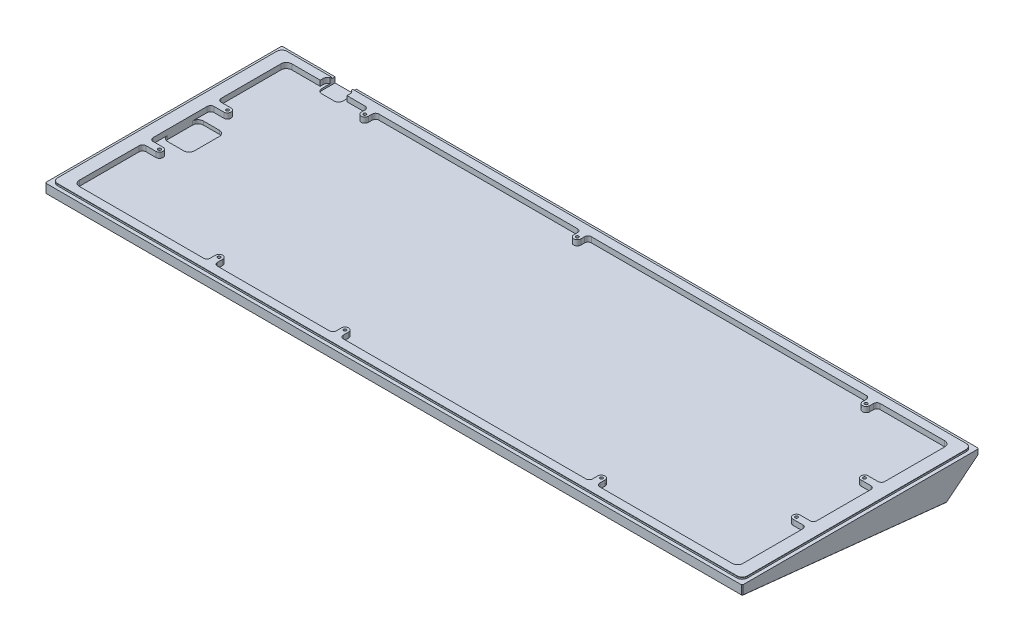
from build123d import *
from OCP.BRepFilletAPI import BRepFilletAPI_MakeChamfer

# Parameters (mm, degrees)
SKETCH1_W                 = 390.7
SKETCH1_H                 = 132.7
MAINBODY_DEPTH            = 18.5
SKETCH2_W                 = 390.7
SKETCH2_H                 = 132.7
SKETCH2_W_2               = 386.7
SKETCH2_H_2               = 128.7
ALIGMENTLIP_DEPTH         = 1
TYPINGANGLE_DEPTH         = 414.035143783
SKETCH4_W                 = 372
SKETCH4_H                 = 119.1
PCBCUTOUT_DEPTH           = 3
SKETCH13_W                = 15
SKETCH13_H                = 20
CUT_EXTRUDE4_DEPTH        = 2
FILLET2_R                 = 3
CHAMFER1_SIZE             = 0.5
CHAMFER1_SIZE_2           = 0.561801899
CHAMFER2_SIZE             = 0.1
SKETCH17_R                = 1
SKETCH17_W                = 2
SKETCH17_H                = 2
CUT_EXTRUDE5_DEPTH        = 1
SKETCH18_W                = 12
SKETCH18_H                = 4
CUT_EXTRUDE6_DEPTH        = 10
SKETCH12_W                = 15
SKETCH12_H                = 3.95
CUT_EXTRUDE3_DEPTH        = 3
FILLET1_R                 = 2.5
SKETCH19_R                = 2
SKETCH19_W                = 4
SKETCH19_H                = 4
SKETCH19_W_2              = 7.45
SKETCH19_H_2              = 4.8
BOSS_EXTRUDE1_DEPTH       = 3
FILLET3_R                 = 1.9
M2X0_4_TAPPED_HOLE1_D     = 1.6
M2X0_4_TAPPED_HOLE1_DEPTH = 4
M2X0_4_TAPPED_HOLE1_TIP   = 0.480688495


# Some blends are built 0.0001 mm under size
with BuildPart() as part:
    # Sketch1 → MainBody (new body)
    with BuildSketch(Plane(origin=(0, 0, 0), x_dir=(1, 0, 0), z_dir=(0, 1, 0))):
        with Locations((195.35, 66.35)):
            Rectangle(SKETCH1_W, SKETCH1_H)
    extrude(amount=MAINBODY_DEPTH)

    # Sketch2 → AligmentLip (cut)
    with BuildSketch(Plane(origin=(0, 18.5, 0), x_dir=(1, 0, 0), z_dir=(0, 1, 0))):
        with Locations((195.35, 66.35)):
            Rectangle(SKETCH2_W, SKETCH2_H)
        with Locations((195.35, 66.35)):
            Rectangle(SKETCH2_W_2, SKETCH2_H_2, mode=Mode.SUBTRACT)
    extrude(amount=-ALIGMENTLIP_DEPTH, mode=Mode.SUBTRACT)

    # Sketch3 → TypingAngle (cut, through all)
    with BuildSketch(Plane.ZY):
        Polygon((-114.79399123, 0), (-132.7, 14.5), (-132.7, 0), align=None)
        Polygon((0, 12.065334661), (-114.79399123, 0), (0, 0), align=None)
    extrude(amount=-TYPINGANGLE_DEPTH, mode=Mode.SUBTRACT)

    # Sketch4 → PCBCutout (cut)
    with BuildSketch(Plane(origin=(0, 18.5, 0), x_dir=(1, 0, 0), z_dir=(0, 1, 0))):
        with Locations((195.35, 66.35)):
            Rectangle(SKETCH4_W, SKETCH4_H)
    extrude(amount=-PCBCUTOUT_DEPTH, mode=Mode.SUBTRACT)

    # Sketch13 → Cut-Extrude4 (cut)
    with BuildSketch(Plane(origin=(0, 15.5, 0), x_dir=(1, 0, 0), z_dir=(0, 1, 0))):
        with Locations((16.85, 66.35)):
            Rectangle(SKETCH13_W, SKETCH13_H)
    extrude(amount=-CUT_EXTRUDE4_DEPTH, mode=Mode.SUBTRACT)

    # Fillet2
    fillet2_edges = [part.edges().sort_by_distance(p)[0] for p in [
        (388.7, 18, -130.7),
        (2, 18, -130.7),
        (2, 18, -2),
        (388.7, 18, -2),
        (9.35, 17, -6.8),
        (9.35, 17, -125.9),
        (381.35, 17, -125.9),
        (381.35, 17, -6.8),
        (9.35, 14.5, -56.35),
        (9.35, 14.5, -76.35),
        (24.35, 14.5, -76.35),
        (24.35, 14.5, -56.35),
    ]]
    fillet(fillet2_edges, radius=FILLET2_R)

    # Chamfer1
    chamfer1_edges_1 = [part.edges().sort_by_distance(p)[0] for p in [
        (0, 16, -132.7),
        (390.7, 16, -132.7),
        (390.7, 14.782667331, 0),
        (0, 14.782667331, 0),
        (0, 7.25, -123.746995615),
        (390.7, 7.25, -123.746995615),
        (0, 6.032667331, -57.396995615),
        (390.7, 6.032667331, -57.396995615),
    ]]
    chamfer1_edges_2 = [part.edges().sort_by_distance(p)[0] for p in [
        (195.35, 12.065334661, 0),
    ]]
    chamfer1_side_2 = [part.faces().sort_by_distance(p)[0] for p in [
        (195.35, 12.064289377, -0.009945219),
    ]]
    chamfer1 = BRepFilletAPI_MakeChamfer(part.part.solid().wrapped)
    for e in chamfer1_edges_1:
        chamfer1.Add(CHAMFER1_SIZE - 0.0001, e.wrapped)
    for e in chamfer1_edges_2:
        chamfer1.Add(CHAMFER1_SIZE_2 - 0.0001, CHAMFER1_SIZE - 0.0001, e.wrapped, chamfer1_side_2[0].wrapped)
    add(Compound.cast(chamfer1.Shape()), mode=Mode.REPLACE)  # a hair under: the kernel refuses the full size

    # Chamfer2
    chamfer2_edges = [part.edges().sort_by_distance(p)[0] for p in [
        (388.7, 18.5, -66.35),
        (195.35, 18.5, -130.7),
        (2, 18.5, -66.35),
        (195.35, 18.5, -2),
        (2.878679656, 18.5, -129.821320344),
        (2.878679656, 18.5, -2.878679656),
        (387.821320344, 18.5, -2.878679656),
        (387.821320344, 18.5, -129.821320344),
    ]]
    chamfer(chamfer2_edges, length=CHAMFER2_SIZE)

    # Sketch17 → Cut-Extrude5 (cut)
    with BuildSketch(Plane(origin=(0, 11.933506406, -1.254262065), x_dir=(1, 0, 0), z_dir=(0, -0.9945218953682734, 0.10452846326765429))):
        with Locations((205.1, -52.238829109)):
            Circle(SKETCH17_R)
        with BuildLine():
            ThreePointArc((204.1, -52.238829109), (205.1, -51.238829109), (206.1, -52.238829109))
            Line((206.1, -52.238829109), (206.1, -49.738829109))
            ThreePointArc((206.1, -49.738829109), (205.1, -50.738829109), (204.1, -49.738829109))
            Line((204.1, -49.738829109), (204.1, -52.238829109))
        make_face()
        with Locations((205.1, -49.738829109)):
            Circle(SKETCH17_R)
        with Locations((201.6, -49.738829109)):
            Circle(SKETCH17_R)
        with BuildLine():
            ThreePointArc((200.6, -60.238829109), (201.6, -59.238829109), (202.6, -60.238829109))
            Line((202.6, -60.238829109), (202.6, -49.738829109))
            ThreePointArc((202.6, -49.738829109), (201.6, -50.738829109), (200.6, -49.738829109))
            Line((200.6, -49.738829109), (200.6, -60.238829109))
        make_face()
        with Locations((201.6, -60.238829109)):
            Circle(SKETCH17_R)
        with Locations((197.1, -53.738829109)):
            Circle(SKETCH17_R)
        with BuildLine():
            Line((196.1, -62.738829109), (198.1, -62.738829109))
            Line((198.1, -62.738829109), (198.1, -53.738829109))
            ThreePointArc((198.1, -53.738829109), (197.1, -54.738829109), (196.1, -53.738829109))
            Line((196.1, -53.738829109), (196.1, -62.738829109))
        make_face()
        with Locations((197.1, -63.738829109)):
            Rectangle(SKETCH17_W, SKETCH17_H)
        with BuildLine():
            ThreePointArc((196.1, -67.738829109), (197.1, -66.738829109), (198.1, -67.738829109))
            Line((198.1, -67.738829109), (198.1, -64.738829109))
            Line((198.1, -64.738829109), (196.1, -64.738829109))
            Line((196.1, -64.738829109), (196.1, -67.738829109))
        make_face()
        with Locations((197.1, -67.738829109)):
            Circle(SKETCH17_R)
        with BuildLine():
            Line((194.1, -64.738829109), (196.1, -64.738829109))
            Line((196.1, -64.738829109), (196.1, -62.738829109))
            Line((196.1, -62.738829109), (194.1, -62.738829109))
            ThreePointArc((194.1, -62.738829109), (194.807106781, -63.031722328), (195.1, -63.738829109))
            ThreePointArc((195.1, -63.738829109), (194.807106781, -64.44593589), (194.1, -64.738829109))
        make_face()
        with Locations((194.1, -63.738829109)):
            Circle(SKETCH17_R)
        with Locations(Location((201.6, -63.738829109, 0), (0, 0, 270))):
            Circle(SKETCH17_R)
        with Locations((192.6, -60.238829109)):
            Circle(SKETCH17_R)
        with BuildLine():
            ThreePointArc((191.6, -60.238829109), (192.6, -59.238829109), (193.6, -60.238829109))
            Line((193.6, -60.238829109), (193.6, -54.238829109))
            ThreePointArc((193.6, -54.238829109), (192.6, -55.238829109), (191.6, -54.238829109))
            Line((191.6, -54.238829109), (191.6, -60.238829109))
        make_face()
        with Locations((192.6, -54.238829109)):
            Circle(SKETCH17_R)
        with BuildLine():
            ThreePointArc((188.1, -60.238829109), (189.1, -59.238829109), (190.1, -60.238829109))
            Line((190.1, -60.238829109), (190.1, -54.238829109))
            ThreePointArc((190.1, -54.238829109), (189.1, -55.238829109), (188.1, -54.238829109))
            Line((188.1, -54.238829109), (188.1, -60.238829109))
        make_face()
        with Locations((189.1, -60.238829109)):
            Circle(SKETCH17_R)
        with Locations((189.1, -54.238829109)):
            Circle(SKETCH17_R)
        with Locations((185.6, -54.238829109)):
            Circle(SKETCH17_R)
        with BuildLine():
            ThreePointArc((184.6, -60.238829109), (185.6, -59.238829109), (186.6, -60.238829109))
            Line((186.6, -60.238829109), (186.6, -54.238829109))
            ThreePointArc((186.6, -54.238829109), (185.6, -55.238829109), (184.6, -54.238829109))
            Line((184.6, -54.238829109), (184.6, -60.238829109))
        make_face()
        with Locations((185.6, -60.238829109)):
            Circle(SKETCH17_R)
    extrude(amount=-CUT_EXTRUDE5_DEPTH, mode=Mode.SUBTRACT)

    # Sketch18 → Cut-Extrude6 (cut)
    with BuildSketch(Plane(origin=(0, 0, -132.7), x_dir=(-1, 0, 0), z_dir=(0, 0, -1))):
        with Locations((-35.8, 16.5)):
            Rectangle(SKETCH18_W, SKETCH18_H)
    extrude(amount=-CUT_EXTRUDE6_DEPTH, mode=Mode.SUBTRACT)

    # Sketch12 → Cut-Extrude3 (cut)
    with BuildSketch(Plane(origin=(0, 18.5, 0), x_dir=(1, 0, 0), z_dir=(0, 1, 0))):
        with Locations((35.8, 127.875)):
            Rectangle(SKETCH12_W, SKETCH12_H)
    extrude(amount=-CUT_EXTRUDE3_DEPTH, mode=Mode.SUBTRACT)

    # Fillet1
    # the kernel refuses this fillet: 2.5 mm, written as the material it adds along each edge
    with BuildSketch(Plane(origin=(43.3, 18.5, -129.85), x_dir=(-1, 0, 0), z_dir=(0, -1, 0))) as fillet1_piece_1_section:
        with BuildLine():
            CenterArc((2.5, -2.291287847), FILLET1_R, 113.578178478, 66.421821522)
            Line((0, -2.291287847), (0, 0))
            Line((0, 0), (1.5, 0))
        make_face()
    fillet1_piece_1 = extrude(amount=8.728219619, mode=Mode.PRIVATE)
    fillet1_piece_1 = split(fillet1_piece_1, bisect_by=Plane(origin=(42.895833366, 13.646672466, -131.646228254), z_dir=(0, 0.7771459614569703, 0.6293203910498382)), keep=Keep.TOP, mode=Mode.PRIVATE)
    add(fillet1_piece_1)
    with BuildSketch(Plane(origin=(28.3, 18.5, -129.85), x_dir=(0, 0, 1), z_dir=(0, -1, 0))) as fillet1_piece_2_section:
        with BuildLine():
            CenterArc((2.291287847, -2.5), FILLET1_R, 90, 66.421821522)
            Line((0, -1.5), (0, 0))
            Line((0, 0), (2.291287847, 0))
        make_face()
    fillet1_piece_2 = extrude(amount=8.728219619, mode=Mode.PRIVATE)
    fillet1_piece_2 = split(fillet1_piece_2, bisect_by=Plane(origin=(28.704166634, 13.646672466, -131.646228254), z_dir=(0, 0.7771459614569703, 0.6293203910498382)), keep=Keep.TOP, mode=Mode.PRIVATE)
    add(fillet1_piece_2)
    with BuildSketch(Plane(origin=(41.8, 8.25, -122.7), x_dir=(0, 0, -1), z_dir=(0, 1, 0))) as fillet1_piece_3_section:
        with BuildLine():
            CenterArc((FILLET1_R, FILLET1_R), FILLET1_R, 180, 90)
            Line((0, FILLET1_R), (0, 0))
            Line((0, 0), (FILLET1_R, 0))
        make_face()
    fillet1_piece_3 = extrude(amount=7.25, mode=Mode.PRIVATE)
    fillet1_piece_3 = split(fillet1_piece_3, bisect_by=Plane(origin=(41.241580153, 10.080392591, -127.242239377), z_dir=(0, 0.7771459614569703, 0.6293203910498382)), keep=Keep.TOP, mode=Mode.PRIVATE)
    add(fillet1_piece_3)
    with BuildSketch(Plane(origin=(29.8, 15.5, -122.7), x_dir=(1, 0, 0), z_dir=(0, -1, 0))) as fillet1_piece_4_section:
        with BuildLine():
            CenterArc((FILLET1_R, -FILLET1_R), FILLET1_R, 90, 90)
            Line((0, -FILLET1_R), (0, 0))
            Line((0, 0), (FILLET1_R, 0))
        make_face()
    fillet1_piece_4 = extrude(amount=7.25, mode=Mode.PRIVATE)
    fillet1_piece_4 = split(fillet1_piece_4, bisect_by=Plane(origin=(30.358419847, 10.080392591, -127.242239377), z_dir=(0, 0.7771459614569703, 0.6293203910498382)), keep=Keep.TOP, mode=Mode.PRIVATE)
    add(fillet1_piece_4)

    # Sketch19 → Boss-Extrude1 (add)
    with BuildSketch(Plane(origin=(0, 15.5, 0), x_dir=(1, 0, 0), z_dir=(0, 1, 0))):
        with Locations((57.3, 121.9)):
            Circle(SKETCH19_R)
        with Locations((176.4, 121.9)):
            Circle(SKETCH19_R)
        with Locations((338.3, 121.9)):
            Circle(SKETCH19_R)
        with Locations((16.8, 85.4)):
            Circle(SKETCH19_R)
        with Locations((16.8, 47.3)):
            Circle(SKETCH19_R)
        with Locations((85.9, 11.6)):
            Circle(SKETCH19_R)
        with Locations((156.5, 11.6)):
            Circle(SKETCH19_R)
        with Locations((300.2, 11.6)):
            Circle(SKETCH19_R)
        with Locations((373.9, 85.4)):
            Circle(SKETCH19_R)
        with Locations((373.9, 47.3)):
            Circle(SKETCH19_R)
        with Locations((57.3, 123.9)):
            Rectangle(SKETCH19_W, SKETCH19_H)
        with Locations((176.4, 123.9)):
            Rectangle(SKETCH19_W, SKETCH19_H)
        with Locations((338.3, 123.9)):
            Rectangle(SKETCH19_W, SKETCH19_H)
        with Locations((377.625, 85.4)):
            Rectangle(SKETCH19_W_2, SKETCH19_H)
        with Locations((377.625, 47.3)):
            Rectangle(SKETCH19_W_2, SKETCH19_H)
        with Locations((300.2, 9.2)):
            Rectangle(SKETCH19_W, SKETCH19_H_2)
        with Locations((156.5, 9.2)):
            Rectangle(SKETCH19_W, SKETCH19_H_2)
        with Locations((85.9, 9.2)):
            Rectangle(SKETCH19_W, SKETCH19_H_2)
        with Locations((13.075, 47.3)):
            Rectangle(SKETCH19_W_2, SKETCH19_H)
        with Locations((13.075, 85.4)):
            Rectangle(SKETCH19_W_2, SKETCH19_H)
    extrude(amount=BOSS_EXTRUDE1_DEPTH)

    # Fillet3
    fillet3_edges = [part.edges().sort_by_distance(p)[0] for p in [
        (9.35, 17, -87.4),
        (9.35, 17, -83.4),
        (178.4, 17, -125.9),
        (174.4, 17, -125.9),
        (381.35, 17, -87.4),
        (381.35, 17, -83.4),
        (298.2, 17, -6.8),
        (302.2, 17, -6.8),
        (87.9, 17, -6.8),
        (83.9, 17, -6.8),
        (154.5, 17, -6.8),
        (158.5, 17, -6.8),
        (381.35, 17, -49.3),
        (381.35, 17, -45.3),
        (340.3, 17, -125.9),
        (336.3, 17, -125.9),
        (59.3, 17, -125.9),
        (55.3, 17, -125.9),
        (9.35, 17, -49.3),
        (9.35, 17, -45.3),
    ]]
    fillet(fillet3_edges, radius=FILLET3_R)

    # M2x0.4 Tapped Hole1
    with Locations(Plane(origin=(57.3, 18.5, -121.9), x_dir=(0, 0, 1), z_dir=(0, 1, 0))):
        with Locations((0, 0), (0, 119.1), (74.6, -40.5), (36.5, -40.5), (110.3, 28.6), (110.3, 99.2), (110.3, 242.9), (74.6, 316.6), (36.5, 316.6), (0, 281)):
            Hole(M2X0_4_TAPPED_HOLE1_D / 2, depth=M2X0_4_TAPPED_HOLE1_DEPTH)
            with Locations((0, 0, -(M2X0_4_TAPPED_HOLE1_DEPTH + M2X0_4_TAPPED_HOLE1_TIP / 2))):  # 118° drill point
                Cone(0, M2X0_4_TAPPED_HOLE1_D / 2, M2X0_4_TAPPED_HOLE1_TIP, mode=Mode.SUBTRACT)


solid = part.part
